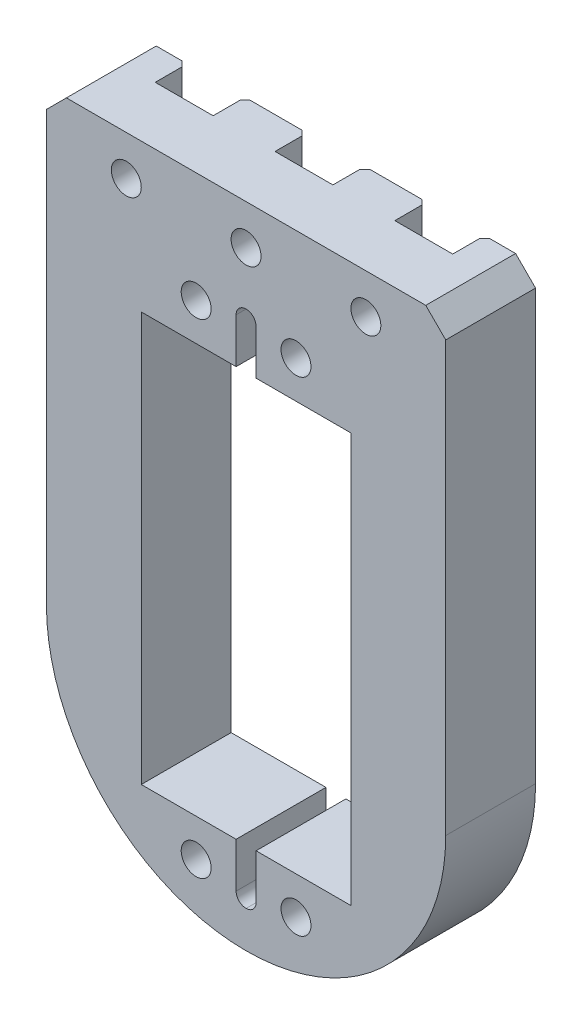
from build123d import *

# Parameters (mm, degrees)
SKETCH_1_W          = 40
SKETCH_1_H          = 65
EXTRUDE_1_DEPTH     = 9
CHAMFER_1_SIZE      = 2
FILLET_3_R          = 20
SKETCH_2_W          = 21
SKETCH_2_H          = 41
CUT_EXTRUDE_1_DEPTH = 10
SKETCH_3_W          = 2
SKETCH_3_H          = 5.5
CUT_EXTRUDE_2_DEPTH = 10
SKETCH_4_R          = 1.5
CUT_EXTRUDE_3_DEPTH = 10
SKETCH_5_R          = 1.5
CUT_EXTRUDE_4_DEPTH = 10
FILLET_4_R          = 1
CUT_EXTRUDE_5_DEPTH = 3.2
CHAMFER_2_SIZE      = 0.5


with BuildPart() as part:
    # 草图1 → 凸台-拉伸1 (new body)
    with BuildSketch(Plane.XY):
        with Locations((20, -37.5)):
            Rectangle(SKETCH_1_W, SKETCH_1_H)
    extrude(amount=EXTRUDE_1_DEPTH)

    # 倒角1
    chamfer_1_edges = [part.edges().sort_by_distance(p)[0] for p in [
        (0, -5, 4.5),
        (40, -5, 4.5),
    ]]
    chamfer(chamfer_1_edges, length=CHAMFER_1_SIZE)

    # 圆角3
    fillet_3_edges = [part.edges().sort_by_distance(p)[0] for p in [
        (0, -70, 4.5),
        (40, -70, 4.5),
    ]]
    fillet(fillet_3_edges, radius=FILLET_3_R - 0.0001)  # a hair under: the kernel refuses the full size

    # 草图2 → 切除-拉伸1 (cut)
    with BuildSketch(Plane(origin=(0, 0, 0), x_dir=(-1, 0, 0), z_dir=(0, 0, -1))):
        with Locations((-20, -40.32)):
            Rectangle(SKETCH_2_W, SKETCH_2_H)
    extrude(amount=-CUT_EXTRUDE_1_DEPTH, mode=Mode.SUBTRACT)

    # 草图3 → 切除-拉伸2 (cut)
    with BuildSketch(Plane.XY.offset(9)):
        with Locations((20, -17.07)):
            Rectangle(SKETCH_3_W, SKETCH_3_H)
        with Locations((20, -63.57)):
            Rectangle(SKETCH_3_W, SKETCH_3_H)
    extrude(amount=-CUT_EXTRUDE_2_DEPTH, mode=Mode.SUBTRACT)

    # 草图4 → 切除-拉伸3 (cut)
    with BuildSketch(Plane(origin=(0, 0, 0), x_dir=(-1, 0, 0), z_dir=(0, 0, -1))):
        with Locations((-25, -16.07)):
            Circle(SKETCH_4_R)
        with Locations((-15, -16.07)):
            Circle(SKETCH_4_R)
        with Locations((-25, -64.57)):
            Circle(SKETCH_4_R)
        with Locations((-15, -64.57)):
            Circle(SKETCH_4_R)
    extrude(amount=-CUT_EXTRUDE_3_DEPTH, mode=Mode.SUBTRACT)

    # 草图5 → 切除-拉伸4 (cut)
    with BuildSketch(Plane(origin=(0, 0, 0), x_dir=(-1, 0, 0), z_dir=(0, 0, -1))):
        with Locations((-32, -9)):
            Circle(SKETCH_5_R)
        with Locations((-20, -9)):
            Circle(SKETCH_5_R)
        with Locations((-8, -9)):
            Circle(SKETCH_5_R)
    extrude(amount=-CUT_EXTRUDE_4_DEPTH, mode=Mode.SUBTRACT)

    # 圆角4
    fillet_4_edges = [part.edges().sort_by_distance(p)[0] for p in [
        (21, -66.32, 4.5),
        (19, -66.32, 4.5),
        (21, -14.32, 4.5),
        (19, -14.32, 4.5),
    ]]
    fillet(fillet_4_edges, radius=FILLET_4_R - 0.0001)  # a hair under: the kernel refuses the full size

    # 草图7 → 切除-拉伸5 (cut)
    with BuildSketch(Plane(origin=(0, 0, 0), x_dir=(-1, 0, 0), z_dir=(0, 0, -1))):
        with BuildLine():
            Line((-34.9, -9), (-34.9, -5))
            Line((-34.9, -5), (-29.1, -5))
            Line((-29.1, -5), (-29.1, -9))
            ThreePointArc((-29.1, -9), (-32, -11.9), (-34.9, -9))
        make_face()
        with BuildLine():
            Line((-17.1, -9), (-17.1, -5))
            Line((-17.1, -5), (-22.9, -5))
            Line((-22.9, -5), (-22.9, -9))
            ThreePointArc((-22.9, -9), (-20, -11.9), (-17.1, -9))
        make_face()
        with BuildLine():
            Line((-5.1, -9), (-5.1, -5))
            Line((-5.1, -5), (-10.9, -5))
            Line((-10.9, -5), (-10.9, -9))
            ThreePointArc((-10.9, -9), (-8, -11.9), (-5.1, -9))
        make_face()
    extrude(amount=-CUT_EXTRUDE_5_DEPTH, mode=Mode.SUBTRACT)

    # 倒角2
    chamfer_2_edges = [part.edges().sort_by_distance(p)[0] for p in [
        (16.5, -16.07, 0),
        (26.5, -64.57, 0),
        (16.5, -64.57, 0),
        (26.5, -16.07, 0),
        (32, -11.9, 0),
        (29.1, -7, 0),
        (34.9, -7, 0),
        (20, -11.9, 0),
        (17.1, -7, 0),
        (22.9, -7, 0),
        (8, -11.9, 0),
        (5.1, -7, 0),
        (10.9, -7, 0),
    ]]
    chamfer(chamfer_2_edges, length=CHAMFER_2_SIZE)


solid = part.part
